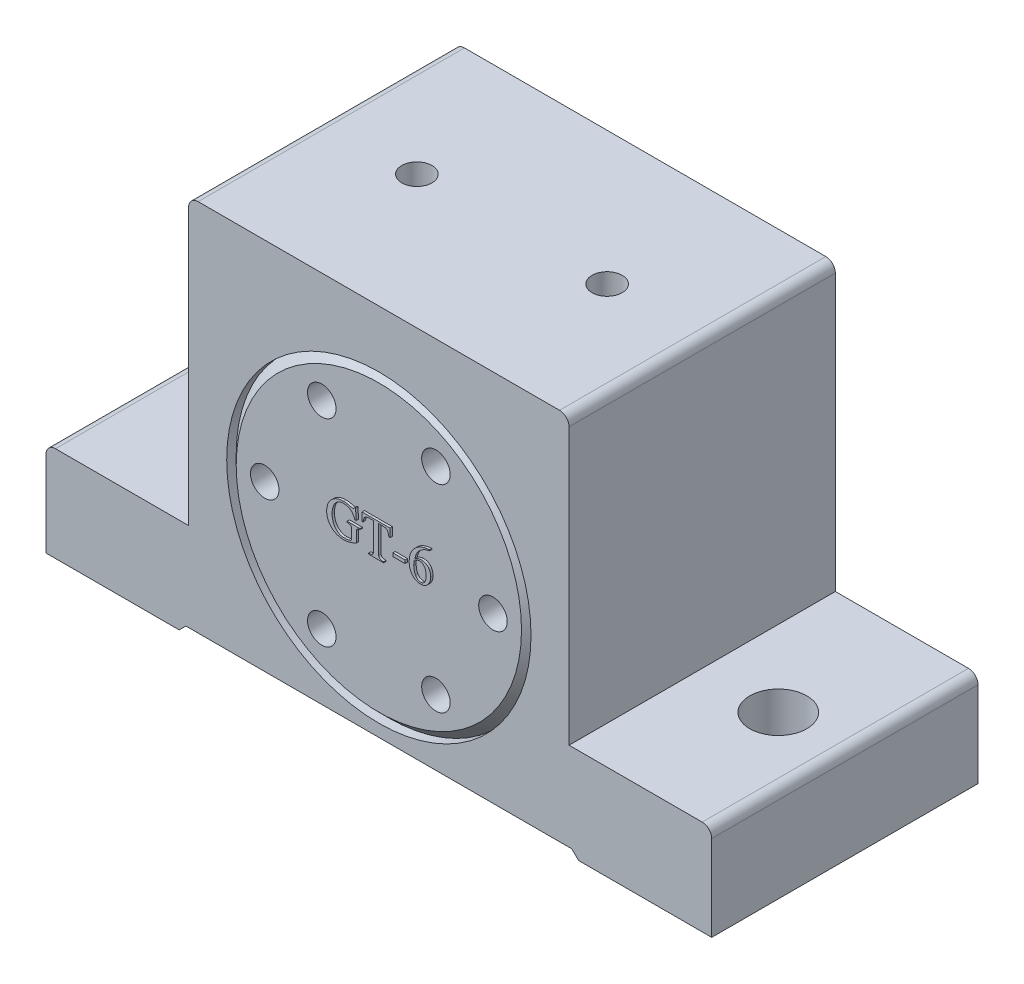
from build123d import *

# Parameters (mm, degrees)
SKETCH1_W                 = 70
SKETCH1_H                 = 28
BOSS_EXTRUDE1_DEPTH       = 10
SKETCH2_W                 = 40
SKETCH2_H                 = 28
BOSS_EXTRUDE2_DEPTH       = 30
F_6_0MM_DOWEL_HOLE1_D     = 6
FILLET1_R                 = 1
FILLET2_R                 = 1
F_6_32_TAPPED_HOLE1_D     = 3.175
F_6_32_TAPPED_HOLE1_DEPTH = 10
F_6_32_TAPPED_HOLE1_TIP   = 0.953866233
SKETCH11_R                = 16
SKETCH11_R_2              = 15
CUT_EXTRUDE1_DEPTH        = 1
CHAMFER1_SIZE             = 1
SKETCH13_R                = 1.5
CUT_EXTRUDE3_DEPTH        = 3
SKETCH14_W                = 1.294520548
SKETCH14_H                = 0.335616438
BOSS_EXTRUDE3_DEPTH       = 0.25
CHAMFER1_OF_MIRROR1_SIZE  = 1
CUT_EXTRUDE2_DEPTH        = 61.074953184
SKETCH15_W                = 1.294520548
SKETCH15_H                = 0.335616438
BOSS_EXTRUDE4_DEPTH       = 0.25


with BuildPart() as part:
    # Sketch1 → Boss-Extrude1 (new body)
    with BuildSketch(Plane(origin=(0, 0, 0), x_dir=(1, 0, 0), z_dir=(0, 1, 0))):
        Rectangle(SKETCH1_W, SKETCH1_H)
    extrude(amount=BOSS_EXTRUDE1_DEPTH)

    # Sketch2 → Boss-Extrude2 (add)
    with BuildSketch(Plane(origin=(0, 10, 0), x_dir=(1, 0, 0), z_dir=(0, 1, 0))):
        Rectangle(SKETCH2_W, SKETCH2_H)
    extrude(amount=BOSS_EXTRUDE2_DEPTH)

    # Ø6.0mm Dowel Hole1 (through all)
    with Locations(Plane(origin=(0, 10, 0), x_dir=(1, 0, 0), z_dir=(0, 1, 0))):
        with Locations((-28, 0), (28, 0)):
            Hole(F_6_0MM_DOWEL_HOLE1_D / 2)

    # Fillet1
    fillet1_edges = [part.edges().sort_by_distance(p)[0] for p in [
        (35, 10, 0),
        (-35, 10, 0),
    ]]
    fillet(fillet1_edges, radius=FILLET1_R)

    # Fillet2
    fillet2_edges = [part.edges().sort_by_distance(p)[0] for p in [
        (-20, 40, 0),
        (20, 40, 0),
    ]]
    fillet(fillet2_edges, radius=FILLET2_R)

    # #6-32 Tapped Hole1
    with Locations(Plane(origin=(0, 40, 0), x_dir=(1, 0, 0), z_dir=(0, 1, 0))):
        with Locations((-10, 0), (10, 0)):
            Hole(F_6_32_TAPPED_HOLE1_D / 2, depth=F_6_32_TAPPED_HOLE1_DEPTH)
            with Locations((0, 0, -(F_6_32_TAPPED_HOLE1_DEPTH + F_6_32_TAPPED_HOLE1_TIP / 2))):  # 118° drill point
                Cone(0, F_6_32_TAPPED_HOLE1_D / 2, F_6_32_TAPPED_HOLE1_TIP, mode=Mode.SUBTRACT)

    # Sketch11 → Cut-Extrude1 (cut)
    with BuildSketch(Plane.XY.offset(14)):
        with Locations((0, 18)):
            Circle(SKETCH11_R)
        with Locations((0, 18)):
            Circle(SKETCH11_R_2, mode=Mode.SUBTRACT)
    cut_extrude1 = extrude(amount=-CUT_EXTRUDE1_DEPTH, mode=Mode.SUBTRACT)

    # Chamfer1
    chamfer1_edges = [part.edges().sort_by_distance(p)[0] for p in [
        (-15, 18, 13),
    ]]
    chamfer(chamfer1_edges, length=CHAMFER1_SIZE - 0.0001)  # a hair under: the kernel refuses the full size

    # Sketch13 → Cut-Extrude3 (cut)
    with BuildSketch(Plane.XY.offset(14)):
        with Locations((12, 18)):
            Circle(SKETCH13_R)
        with Locations((6, 7.607695155)):
            Circle(SKETCH13_R)
        with Locations((-6, 7.607695155)):
            Circle(SKETCH13_R)
        with Locations((-12, 18)):
            Circle(SKETCH13_R)
        with Locations((-6, 28.392304845)):
            Circle(SKETCH13_R)
        with Locations((6, 28.392304845)):
            Circle(SKETCH13_R)
    cut_extrude3 = extrude(amount=-CUT_EXTRUDE3_DEPTH, mode=Mode.SUBTRACT)

    # Sketch14 → Boss-Extrude3 (add)
    # profile 1 of 4: a face of its own
    with BuildSketch(Plane.XY.offset(14)):
        with BuildLine():
            add(Edge.make_bspline(
                [(-1.739432429, 18.884858151), (-1.76947184, 18.883983773), (-1.826025777, 18.882337618), (-1.905135798, 18.866825645), (-1.972343777, 18.84067568), (-2.028603501, 18.804330982), (-2.071428699, 18.755601741), (-2.102178768, 18.696591468), (-2.119994879, 18.627170215), (-2.121960671, 18.577565796), (-2.122994073, 18.551489144)],
                knots=[0, 0, 0, 0, 1.239001329, 2.332615703, 3.308784426, 4.200724742, 5.069554961, 5.954799651, 6.924854295, 8, 8, 8, 8], degree=3))
            Line((-2.122994073, 18.551489144), (-2.122994073, 17.469725446))
            add(Edge.make_bspline(
                [(-2.122994073, 17.469725446), (-2.184235195, 17.441337352), (-2.303583141, 17.386014057), (-2.481184078, 17.312140431), (-2.6527911, 17.250636324), (-2.817868072, 17.200461608), (-2.975879904, 17.159797216), (-3.127669441, 17.132605261), (-3.27270264, 17.113709566), (-3.367515754, 17.111811494), (-3.413768901, 17.110885548)],
                knots=[0, 0, 0, 0, 1.199725496, 2.338049464, 3.417678333, 4.438440892, 5.404069907, 6.315575426, 7.178278878, 8, 8, 8, 8], degree=3))
            add(Edge.make_bspline(
                [(-3.413768901, 17.110885548), (-3.483525714, 17.112316991), (-3.62003025, 17.115118128), (-3.819081559, 17.141429706), (-4.007539347, 17.182591858), (-4.184415296, 17.242603941), (-4.351659446, 17.317170541), (-4.506923665, 17.411000675), (-4.652433525, 17.520234056), (-4.738447683, 17.605758996), (-4.781705545, 17.648770822)],
                knots=[0, 0, 0, 0, 1.10601814, 2.164326138, 3.17915268, 4.161213173, 5.122074661, 6.077893338, 7.033342586, 8, 8, 8, 8], degree=3))
            add(Edge.make_bspline(
                [(-4.781705545, 17.648770822), (-4.818267902, 17.689781435), (-4.890633642, 17.770951348), (-4.98344663, 17.903903561), (-5.062929847, 18.043141446), (-5.127217836, 18.18965992), (-5.177885241, 18.342866479), (-5.213703385, 18.502677893), (-5.234945975, 18.669531344), (-5.237918502, 18.782912796), (-5.239432429, 18.840658665)],
                knots=[0, 0, 0, 0, 1.006742773, 1.99258728, 2.966642265, 3.942535995, 4.921400946, 5.921194709, 6.941251712, 8, 8, 8, 8], degree=3))
            add(Edge.make_bspline(
                [(-5.239432429, 18.840658665), (-5.237781399, 18.903655708), (-5.234546404, 19.027090812), (-5.211149099, 19.208058545), (-5.171415635, 19.380430815), (-5.11577932, 19.544245684), (-5.045204974, 19.700020142), (-4.957541382, 19.846634192), (-4.854555396, 19.985090074), (-4.736450888, 20.113250443), (-4.606733801, 20.229265603), (-4.468742715, 20.332300882), (-4.321519355, 20.41767582), (-4.167413599, 20.488657176), (-4.005221084, 20.543711607), (-3.834965585, 20.582115448), (-3.656987059, 20.607187082), (-3.535466565, 20.609639194), (-3.473700408, 20.610885548)],
                knots=[0, 0, 0, 0, 1.080545691, 2.117198862, 3.124119818, 4.110324757, 5.080319471, 6.052289168, 7.034998981, 8.035502578, 9.036592937, 10.016750459, 10.984367975, 11.950467093, 12.923125672, 13.916561085, 14.941034463, 16, 16, 16, 16], degree=3))
            add(Edge.make_bspline(
                [(-3.473700408, 20.610885548), (-3.423974204, 20.610046651), (-3.32533639, 20.6083826), (-3.178742633, 20.594286009), (-3.034751869, 20.572374668), (-2.897060261, 20.540198307), (-2.770776161, 20.508162053), (-2.66010227, 20.485587888), (-2.568883439, 20.470621606), (-2.514086357, 20.468138164), (-2.490074552, 20.467049932)],
                knots=[0, 0, 0, 0, 1.197159582, 2.374707746, 3.54323986, 4.701578201, 5.777914313, 6.6800664, 7.421611739, 8, 8, 8, 8], degree=3))
            add(Edge.make_bspline(
                [(-2.490074552, 20.467049932), (-2.468979685, 20.468525149), (-2.428530969, 20.471353828), (-2.374033945, 20.500725624), (-2.332290672, 20.548712388), (-2.316977772, 20.589209827), (-2.308781744, 20.610885548)],
                knots=[0, 0, 0, 0, 1.007193199, 1.931259918, 2.892734066, 4, 4, 4, 4], degree=3))
            Line((-2.308781744, 20.610885548), (-2.194911881, 20.610885548))
            Line((-2.194911881, 20.610885548), (-2.143220956, 19.508145822))
            Line((-2.143220956, 19.508145822), (-2.268327977, 19.508145822))
            add(Edge.make_bspline(
                [(-2.268327977, 19.508145822), (-2.281071306, 19.545039556), (-2.306086328, 19.617461565), (-2.351195826, 19.720731076), (-2.400946409, 19.816790682), (-2.453650125, 19.906615641), (-2.512612054, 19.988375583), (-2.575307751, 20.063659817), (-2.643244675, 20.131318137), (-2.715108576, 20.192392285), (-2.792107824, 20.245653603), (-2.873099351, 20.292462698), (-2.959271222, 20.331469198), (-3.04970408, 20.363672452), (-3.145010371, 20.388370686), (-3.244402421, 20.406305821), (-3.348615015, 20.416879219), (-3.419488054, 20.418351859), (-3.455720956, 20.419104727)],
                knots=[0, 0, 0, 0, 1.158273263, 2.273678194, 3.341159708, 4.368298708, 5.361802656, 6.329845504, 7.273283785, 8.204323484, 9.125515029, 10.048583427, 10.977348367, 11.929193547, 12.894650509, 13.896415442, 14.924570273, 16, 16, 16, 16], degree=3))
            add(Edge.make_bspline(
                [(-3.455720956, 20.419104727), (-3.503012786, 20.418011445), (-3.595626879, 20.415870414), (-3.729984437, 20.39323084), (-3.856841592, 20.358505782), (-3.974827661, 20.307618121), (-4.085680201, 20.243825989), (-4.186823905, 20.164037516), (-4.281397786, 20.071559597), (-4.334876281, 20.000110601), (-4.362184997, 19.963625274)],
                knots=[0, 0, 0, 0, 1.072326228, 2.099993195, 3.083193723, 4.050587198, 5.008019062, 5.977269977, 6.967095844, 8, 8, 8, 8], degree=3))
            add(Edge.make_bspline(
                [(-4.362184997, 19.963625274), (-4.386378007, 19.927601096), (-4.435249011, 19.85483058), (-4.496093018, 19.736229727), (-4.549127385, 19.610273833), (-4.590653856, 19.475076622), (-4.623583492, 19.331599985), (-4.6472848, 19.179664624), (-4.661853499, 19.019241386), (-4.663331862, 18.909611853), (-4.664089963, 18.85339411)],
                knots=[0, 0, 0, 0, 0.890046138, 1.79793457, 2.730814706, 3.692169857, 4.696823079, 5.750191814, 6.846304133, 8, 8, 8, 8], degree=3))
            add(Edge.make_bspline(
                [(-4.664089963, 18.85339411), (-4.663187967, 18.798662399), (-4.661420849, 18.691436372), (-4.644459532, 18.534155115), (-4.617152216, 18.384010473), (-4.577890117, 18.241020098), (-4.528486755, 18.10514245), (-4.468738563, 17.97598349), (-4.395936203, 17.855207394), (-4.314310308, 17.741477141), (-4.222833583, 17.638309054), (-4.122426254, 17.54848342), (-4.014866079, 17.472045694), (-3.89917436, 17.410331909), (-3.77622239, 17.362070306), (-3.645510949, 17.327752154), (-3.507381221, 17.306160211), (-3.412601312, 17.303845409), (-3.364325408, 17.30266637)],
                knots=[0, 0, 0, 0, 1.156412547, 2.265551758, 3.339008266, 4.378653555, 5.395448493, 6.391821337, 7.381124235, 8.371369896, 9.347007419, 10.288900617, 11.212879788, 12.129033041, 13.05323828, 13.998010424, 14.980291741, 16, 16, 16, 16], degree=3))
            add(Edge.make_bspline(
                [(-3.364325408, 17.30266637), (-3.317592799, 17.303445878), (-3.225650288, 17.304979493), (-3.091159113, 17.319498006), (-2.962787789, 17.342979863), (-2.860994456, 17.368803482), (-2.786206352, 17.395178203), (-2.737712693, 17.414943376), (-2.696157863, 17.435871279), (-2.66289805, 17.458815722), (-2.635923815, 17.482452383), (-2.617092513, 17.507961086), (-2.604703325, 17.534862134), (-2.603186753, 17.553511678), (-2.602446127, 17.562619281)],
                knots=[0, 0, 0, 0, 1.975665256, 3.886956615, 5.711694527, 7.491797299, 8.32003784, 9.06327313, 9.705589786, 10.282612917, 10.768470237, 11.214106252, 11.616204631, 12, 12, 12, 12], degree=3))
            Line((-2.602446127, 17.562619281), (-2.602446127, 18.527516542))
            add(Edge.make_bspline(
                [(-2.602446127, 18.527516542), (-2.603703508, 18.555656447), (-2.606096246, 18.609205415), (-2.629076536, 18.68408399), (-2.667430423, 18.747741961), (-2.721933443, 18.799254527), (-2.791425357, 18.838499628), (-2.875523049, 18.86536478), (-2.973805531, 18.882828361), (-3.044355185, 18.88415316), (-3.081898182, 18.884858151)],
                knots=[0, 0, 0, 0, 0.98951328, 1.882999076, 2.728159263, 3.580845107, 4.495530347, 5.516815598, 6.678573455, 8, 8, 8, 8], degree=3))
            Line((-3.081898182, 18.884858151), (-3.081898182, 18.980748562))
            Line((-3.081898182, 18.980748562), (-1.739432429, 18.980748562))
            Line((-1.739432429, 18.980748562), (-1.739432429, 18.884858151))
        make_face()
    # profile 2 of 4: a face of its own
    with BuildSketch(Plane.XY.offset(14)):
        with BuildLine():
            Line((1.43993401, 19.74787185), (1.317823564, 19.74787185))
            add(Edge.make_bspline(
                [(1.317823564, 19.74787185), (1.310264199, 19.779133274), (1.295955722, 19.838305358), (1.272911961, 19.921434783), (1.253127549, 19.994795211), (1.234430766, 20.058006003), (1.216987813, 20.111056062), (1.202517257, 20.154887209), (1.188690148, 20.188447049), (1.178840691, 20.206900261), (1.174737092, 20.214588459)],
                knots=[0, 0, 0, 0, 1.578320812, 2.987468802, 4.233238226, 5.307310078, 6.221953995, 6.973835255, 7.572466902, 8, 8, 8, 8], degree=3))
            add(Edge.make_bspline(
                [(1.174737092, 20.214588459), (1.162987089, 20.230971788), (1.139690494, 20.263454825), (1.095796685, 20.305411253), (1.045218855, 20.340374419), (0.988323492, 20.370236995), (0.92436006, 20.392288813), (0.853713144, 20.407814437), (0.776723376, 20.417732397), (0.72303534, 20.418637102), (0.695285037, 20.419104727)],
                knots=[0, 0, 0, 0, 0.88751667, 1.759668995, 2.660809804, 3.591599553, 4.584102421, 5.633891444, 6.777004475, 8, 8, 8, 8], degree=3))
            Line((0.695285037, 20.419104727), (0.226320996, 20.419104727))
            Line((0.226320996, 20.419104727), (0.226320996, 17.564866713))
            add(Edge.make_bspline(
                [(0.226320996, 17.564866713), (0.227711171, 17.536689009), (0.230367015, 17.482857236), (0.255919327, 17.4076535), (0.298408726, 17.343878307), (0.358684337, 17.292783625), (0.434513121, 17.252731171), (0.527043287, 17.226289981), (0.634939259, 17.208774031), (0.712432775, 17.207470454), (0.753718256, 17.206775959)],
                knots=[0, 0, 0, 0, 0.933336804, 1.783082706, 2.601954345, 3.448456312, 4.379764321, 5.429141126, 6.630348073, 8, 8, 8, 8], degree=3))
            Line((0.753718256, 17.206775959), (0.753718256, 17.110885548))
            Line((0.753718256, 17.110885548), (-0.828473525, 17.110885548))
            Line((-0.828473525, 17.110885548), (-0.828473525, 17.206775959))
            add(Edge.make_bspline(
                [(-0.828473525, 17.206775959), (-0.787188044, 17.207470454), (-0.709694527, 17.208774031), (-0.601798556, 17.226289981), (-0.509268389, 17.252731171), (-0.433439606, 17.292783625), (-0.373163994, 17.343878307), (-0.330674595, 17.4076535), (-0.305122284, 17.482857236), (-0.302466439, 17.536689009), (-0.301076264, 17.564866713)],
                knots=[0, 0, 0, 0, 1.369651927, 2.570858874, 3.620235679, 4.551543688, 5.398045655, 6.216917294, 7.066663196, 8, 8, 8, 8], degree=3))
            Line((-0.301076264, 17.564866713), (-0.301076264, 20.419104727))
            Line((-0.301076264, 20.419104727), (-0.7220951, 20.419104727))
            add(Edge.make_bspline(
                [(-0.7220951, 20.419104727), (-0.754840613, 20.418679266), (-0.817743466, 20.417861973), (-0.907810019, 20.407543175), (-0.989993561, 20.393311719), (-1.063853374, 20.371921706), (-1.129115657, 20.343009389), (-1.186438332, 20.308856973), (-1.235689655, 20.2681277), (-1.261485592, 20.235789257), (-1.274214107, 20.219832466)],
                knots=[0, 0, 0, 0, 1.289740232, 2.477540615, 3.568090296, 4.573823554, 5.49906424, 6.373287038, 7.197329409, 8, 8, 8, 8], degree=3))
            add(Edge.make_bspline(
                [(-1.274214107, 20.219832466), (-1.279595596, 20.210919072), (-1.291849761, 20.190622423), (-1.308814384, 20.15459194), (-1.325803156, 20.109111123), (-1.343560681, 20.054556905), (-1.362135346, 19.990811469), (-1.381760178, 19.918221573), (-1.400856734, 19.83608594), (-1.414072917, 19.778340584), (-1.421046299, 19.74787185)],
                knots=[0, 0, 0, 0, 0.503456748, 1.146419101, 1.922638869, 2.850904366, 3.921183567, 5.134293639, 6.487939951, 8, 8, 8, 8], degree=3))
            Line((-1.421046299, 19.74787185), (-1.547651607, 19.74787185))
            Line((-1.547651607, 19.74787185), (-1.51693671, 20.610885548))
            Line((-1.51693671, 20.610885548), (1.409219112, 20.610885548))
            Line((1.409219112, 20.610885548), (1.43993401, 19.74787185))
        make_face()
    # profile 3 of 4: a face of its own
    with BuildSketch(Plane.XY.offset(14)):
        with Locations((2.35988264, 18.333488288)):
            Rectangle(SKETCH14_W, SKETCH14_H)
    # profile 4 of 4: a face of its own
    with BuildSketch(Plane.XY.offset(14)):
        with BuildLine():
            add(Edge.make_bspline(
                [(5.692074421, 18.293783665), (5.691339047, 18.251285177), (5.689902834, 18.16828404), (5.674929497, 18.046828641), (5.652304092, 17.931101483), (5.619032004, 17.821352192), (5.577011702, 17.717102701), (5.525329064, 17.618950901), (5.464032048, 17.52661215), (5.393956334, 17.441371149), (5.317546832, 17.363085768), (5.233460143, 17.296345498), (5.144913287, 17.238775666), (5.050254523, 17.192206967), (4.950509638, 17.154996736), (4.844745705, 17.13017444), (4.734188251, 17.113673858), (4.658567762, 17.111826514), (4.620049592, 17.110885548)],
                knots=[0, 0, 0, 0, 1.138424546, 2.223385749, 3.274696689, 4.295201745, 5.291904765, 6.282793953, 7.262843492, 8.256869163, 9.236461589, 10.188625493, 11.127955327, 12.061761684, 13.010343885, 13.974521034, 14.968298855, 16, 16, 16, 16], degree=3))
            add(Edge.make_bspline(
                [(4.620049592, 17.110885548), (4.576781652, 17.112249971), (4.492078904, 17.114921009), (4.368102736, 17.133862569), (4.250476884, 17.165836205), (4.139765841, 17.212400229), (4.034592693, 17.269971121), (3.936827329, 17.341951272), (3.845718961, 17.426698299), (3.761437822, 17.523144817), (3.68547987, 17.629828122), (3.619000402, 17.745132508), (3.563982142, 17.868418998), (3.517908397, 17.998888338), (3.482126648, 18.136726939), (3.456704662, 18.282267614), (3.441712177, 18.435305187), (3.439685297, 18.539968625), (3.438649763, 18.593441199)],
                knots=[0, 0, 0, 0, 0.976955377, 1.912520094, 2.825093943, 3.722645334, 4.618778232, 5.526810146, 6.456646236, 7.423786005, 8.414367999, 9.409754318, 10.424428233, 11.458937211, 12.531335076, 13.636521686, 14.79249839, 16, 16, 16, 16], degree=3))
            add(Edge.make_bspline(
                [(3.438649763, 18.593441199), (3.439877345, 18.658704513), (3.442298821, 18.787440119), (3.467848696, 18.976697613), (3.50492468, 19.159843361), (3.560574045, 19.335526337), (3.629632808, 19.505209342), (3.717407159, 19.666334548), (3.816947157, 19.823157459), (3.896079773, 19.919446219), (3.93608127, 19.968120137)],
                knots=[0, 0, 0, 0, 1.047607078, 2.066464669, 3.062342177, 4.045498137, 5.021996458, 5.999943445, 6.988972453, 8, 8, 8, 8], degree=3))
            add(Edge.make_bspline(
                [(3.93608127, 19.968120137), (3.960464832, 19.995904957), (4.008965521, 20.051170997), (4.087510909, 20.128217944), (4.168933922, 20.20113753), (4.254741904, 20.268598746), (4.344019724, 20.331584865), (4.436820682, 20.390265166), (4.533735483, 20.443062716), (4.633588672, 20.492462753), (4.737759129, 20.535315944), (4.845367819, 20.574658525), (4.956613293, 20.609006218), (5.071711471, 20.638066144), (5.190101328, 20.663058977), (5.312431888, 20.682154882), (5.438358891, 20.697415076), (5.52373429, 20.703629199), (5.5669674, 20.706775959)],
                knots=[0, 0, 0, 0, 0.963012201, 1.915501779, 2.864985772, 3.810133893, 4.757988675, 5.711255931, 6.669441194, 7.632739165, 8.612836501, 9.602992112, 10.617732192, 11.645182806, 12.69551986, 13.769616166, 14.870559531, 16, 16, 16, 16], degree=3))
            Line((5.5669674, 20.706775959), (5.577455414, 20.612383836))
            add(Edge.make_bspline(
                [(5.577455414, 20.612383836), (5.529096349, 20.603899473), (5.433103063, 20.587057916), (5.293454235, 20.548799084), (5.15838096, 20.503608417), (5.029601337, 20.447517116), (4.905145557, 20.384137893), (4.787139629, 20.310290255), (4.673434462, 20.228550119), (4.603092026, 20.16698391), (4.567609523, 20.135928357)],
                knots=[0, 0, 0, 0, 1.039676805, 2.063770088, 3.064263804, 4.054889119, 5.036858801, 6.020508793, 7.001494587, 8, 8, 8, 8], degree=3))
            add(Edge.make_bspline(
                [(4.567609523, 20.135928357), (4.532298888, 20.102047119), (4.462593311, 20.035163267), (4.369449469, 19.925720115), (4.287304721, 19.810782974), (4.216777284, 19.689814838), (4.157381358, 19.56346145), (4.109027796, 19.431736384), (4.072996297, 19.294140938), (4.057683971, 19.199896594), (4.049951133, 19.152302501)],
                knots=[0, 0, 0, 0, 1.034200225, 2.04158106, 3.033469562, 4.017839106, 4.998064994, 5.981924621, 6.980856969, 8, 8, 8, 8], degree=3))
            add(Edge.make_bspline(
                [(4.049951133, 19.152302501), (4.079791374, 19.16900983), (4.138084912, 19.201647951), (4.225636856, 19.245692986), (4.311904173, 19.281088326), (4.395141814, 19.311639949), (4.476233827, 19.335094932), (4.555164055, 19.351312757), (4.631694943, 19.362882266), (4.682188023, 19.363840352), (4.706950277, 19.364310206)],
                knots=[0, 0, 0, 0, 1.175784807, 2.296920369, 3.366786594, 4.379748116, 5.344406239, 6.265442073, 7.149357401, 8, 8, 8, 8], degree=3))
            add(Edge.make_bspline(
                [(4.706950277, 19.364310206), (4.744695444, 19.363476916), (4.818191892, 19.361854355), (4.925161133, 19.348404278), (5.025499751, 19.32503913), (5.119709445, 19.292802852), (5.207788574, 19.251604268), (5.289588294, 19.200930109), (5.364753162, 19.140768967), (5.432786254, 19.071410993), (5.494073509, 18.99556015), (5.546984926, 18.912753764), (5.592045004, 18.824231438), (5.628589371, 18.729529629), (5.657416, 18.629021051), (5.676891016, 18.522607637), (5.690532134, 18.410252542), (5.691551378, 18.333282298), (5.692074421, 18.293783665)],
                knots=[0, 0, 0, 0, 1.101175742, 2.144181948, 3.139304406, 4.10254167, 5.044598947, 5.970711362, 6.903877635, 7.846808139, 8.800461266, 9.744404827, 10.709019207, 11.694140181, 12.702066175, 13.755330833, 14.848108567, 16, 16, 16, 16], degree=3))
        make_face()
        with BuildLine():
            add(Edge.make_bspline(
                [(5.212622366, 18.151446336), (5.21201435, 18.192662344), (5.210837573, 18.272433306), (5.202736434, 18.388261608), (5.188630801, 18.496085232), (5.169080163, 18.5961419), (5.145199741, 18.688774212), (5.113155809, 18.772573578), (5.077712561, 18.849158276), (5.03530449, 18.917204917), (4.987421715, 18.977463566), (4.933616519, 19.029590883), (4.874847002, 19.074465512), (4.809730652, 19.110691223), (4.738746348, 19.138166571), (4.662690599, 19.158509064), (4.580989747, 19.170717871), (4.524701464, 19.171913291), (4.495691715, 19.172529384)],
                knots=[0, 0, 0, 0, 1.394582776, 2.699126296, 3.926404794, 5.071464784, 6.147512232, 7.158212172, 8.103087745, 8.998738382, 9.864393069, 10.700939639, 11.527311007, 12.359493626, 13.213063892, 14.096434317, 15.018943932, 16, 16, 16, 16], degree=3))
            add(Edge.make_bspline(
                [(4.495691715, 19.172529384), (4.457809231, 19.170550215), (4.380764644, 19.166525022), (4.266159114, 19.136293653), (4.151134588, 19.088844285), (4.079070683, 19.043803635), (4.041710551, 19.020453185)],
                knots=[0, 0, 0, 0, 0.935559524, 1.902720987, 2.912706425, 4, 4, 4, 4], degree=3))
            add(Edge.make_bspline(
                [(4.041710551, 19.020453185), (4.030632127, 19.011237357), (4.00695271, 18.991539118), (3.981440969, 18.947565959), (3.959073443, 18.893240863), (3.941543786, 18.826177354), (3.929700693, 18.747072191), (3.920387474, 18.656083126), (3.917414269, 18.552504651), (3.917863986, 18.479319559), (3.918101818, 18.440615857)],
                knots=[0, 0, 0, 0, 0.563473274, 1.204387778, 1.971219796, 2.877449815, 3.923165741, 5.118574131, 6.476167144, 8, 8, 8, 8], degree=3))
            add(Edge.make_bspline(
                [(3.918101818, 18.440615857), (3.919412355, 18.402380928), (3.921969378, 18.327779815), (3.933071999, 18.218601355), (3.947319474, 18.114122813), (3.968670924, 18.014976043), (3.993700012, 17.920347007), (4.025597022, 17.831547704), (4.060925583, 17.746971446), (4.089700646, 17.694246817), (4.103889489, 17.668248562)],
                knots=[0, 0, 0, 0, 1.143730031, 2.231559842, 3.280238669, 4.295193579, 5.262550965, 6.20491294, 7.114851382, 8, 8, 8, 8], degree=3))
            add(Edge.make_bspline(
                [(4.103889489, 17.668248562), (4.121479069, 17.639348784), (4.155607465, 17.583275642), (4.216112516, 17.508374541), (4.282436745, 17.444731782), (4.354810878, 17.392257855), (4.433625354, 17.352409748), (4.51780744, 17.323696862), (4.607832814, 17.30604648), (4.669911285, 17.303811215), (4.70170627, 17.30266637)],
                knots=[0, 0, 0, 0, 1.099409185, 2.133141947, 3.121167614, 4.081329256, 5.029323335, 5.982175394, 6.966522497, 8, 8, 8, 8], degree=3))
            add(Edge.make_bspline(
                [(4.70170627, 17.30266637), (4.720735769, 17.303401162), (4.75784605, 17.304834112), (4.812105571, 17.315670465), (4.863432975, 17.333609736), (4.911607661, 17.359560374), (4.957192505, 17.392015986), (4.999259912, 17.432526447), (5.039006448, 17.479527949), (5.074537898, 17.53403771), (5.107823394, 17.59346121), (5.135144722, 17.659354421), (5.158955285, 17.729726552), (5.179501026, 17.804634509), (5.194241466, 17.884612262), (5.204332215, 17.969205928), (5.211486774, 18.058681775), (5.212237011, 18.119967358), (5.212622366, 18.151446336)],
                knots=[0, 0, 0, 0, 0.829717635, 1.618069638, 2.403631806, 3.193112014, 3.997262433, 4.837215108, 5.734085466, 6.676760067, 7.671381335, 8.701290833, 9.783017025, 10.91140516, 12.086521174, 13.32693086, 14.626993802, 16, 16, 16, 16], degree=3))
        make_face(mode=Mode.SUBTRACT)
    extrude(amount=BOSS_EXTRUDE3_DEPTH)

    # Mirror1: Cut-Extrude1, Cut-Extrude3 across plane
    add(cut_extrude1.mirror(Plane.XY), mode=Mode.SUBTRACT)
    add(cut_extrude3.mirror(Plane.XY), mode=Mode.SUBTRACT)

    # Chamfer1 of Mirror1
    chamfer1_of_mirror1_edges = [part.edges().sort_by_distance(p)[0] for p in [
        (-15, 18, -13),
    ]]
    chamfer(chamfer1_of_mirror1_edges, length=CHAMFER1_OF_MIRROR1_SIZE - 0.0001)  # a hair under: the kernel refuses the full size

    # Sketch12 → Cut-Extrude2 (cut, through all)
    with BuildSketch(Plane.XY.offset(14)):
        Polygon((-21, 0), (-20.292893219, 0.707106781), (20.292893219, 0.707106781), (21, 0), align=None)
    extrude(amount=-CUT_EXTRUDE2_DEPTH, mode=Mode.SUBTRACT)

    # Sketch15 → Boss-Extrude4 (add)
    # profile 1 of 4: a face of its own
    with BuildSketch(Plane(origin=(0, 0, -14), x_dir=(-1, 0, 0), z_dir=(0, 0, -1))):
        with BuildLine():
            add(Edge.make_bspline(
                [(-1.846802072, 18.836912946), (-1.876841483, 18.836038568), (-1.93339542, 18.834392413), (-2.012505441, 18.81888044), (-2.079713419, 18.792730475), (-2.135973144, 18.756385777), (-2.178798342, 18.707656535), (-2.209548411, 18.648646263), (-2.227364522, 18.579225009), (-2.229330314, 18.529620591), (-2.230363716, 18.503543939)],
                knots=[0, 0, 0, 0, 1.239001329, 2.332615703, 3.308784426, 4.200724742, 5.069554961, 5.954799651, 6.924854295, 8, 8, 8, 8], degree=3))
            Line((-2.230363716, 18.503543939), (-2.230363716, 17.42178024))
            add(Edge.make_bspline(
                [(-2.230363716, 17.42178024), (-2.291604838, 17.393392146), (-2.410952784, 17.338068851), (-2.588553721, 17.264195226), (-2.760160743, 17.202691118), (-2.925237715, 17.152516403), (-3.083249547, 17.11185201), (-3.235039084, 17.084660055), (-3.380072283, 17.06576436), (-3.474885397, 17.063866289), (-3.521138544, 17.062940343)],
                knots=[0, 0, 0, 0, 1.199725496, 2.338049464, 3.417678333, 4.438440892, 5.404069907, 6.315575426, 7.178278878, 8, 8, 8, 8], degree=3))
            add(Edge.make_bspline(
                [(-3.521138544, 17.062940343), (-3.590895357, 17.064371785), (-3.727399893, 17.067172923), (-3.926451202, 17.093484501), (-4.11490899, 17.134646652), (-4.291784939, 17.194658736), (-4.459029089, 17.269225336), (-4.614293308, 17.36305547), (-4.759803168, 17.472288851), (-4.845817326, 17.557813791), (-4.889075188, 17.600825617)],
                knots=[0, 0, 0, 0, 1.10601814, 2.164326138, 3.17915268, 4.161213173, 5.122074661, 6.077893338, 7.033342586, 8, 8, 8, 8], degree=3))
            add(Edge.make_bspline(
                [(-4.889075188, 17.600825617), (-4.925637545, 17.641836229), (-4.998003285, 17.723006143), (-5.090816273, 17.855958355), (-5.17029949, 17.995196241), (-5.234587479, 18.141714715), (-5.285254884, 18.294921274), (-5.321073028, 18.454732688), (-5.342315618, 18.621586138), (-5.345288145, 18.73496759), (-5.346802072, 18.792713459)],
                knots=[0, 0, 0, 0, 1.006742773, 1.99258728, 2.966642265, 3.942535995, 4.921400946, 5.921194709, 6.941251712, 8, 8, 8, 8], degree=3))
            add(Edge.make_bspline(
                [(-5.346802072, 18.792713459), (-5.345151042, 18.855710503), (-5.341916047, 18.979145606), (-5.318518742, 19.16011334), (-5.278785278, 19.33248561), (-5.223148963, 19.496300478), (-5.152574617, 19.652074936), (-5.064911025, 19.798688987), (-4.961925039, 19.937144868), (-4.843820531, 20.065305238), (-4.714103444, 20.181320397), (-4.576112358, 20.284355676), (-4.428888998, 20.369730614), (-4.274783242, 20.440711971), (-4.112590727, 20.495766401), (-3.942335228, 20.534170243), (-3.764356702, 20.559241876), (-3.642836208, 20.561693989), (-3.581070051, 20.562940343)],
                knots=[0, 0, 0, 0, 1.080545691, 2.117198862, 3.124119818, 4.110324757, 5.080319471, 6.052289168, 7.034998981, 8.035502578, 9.036592937, 10.016750459, 10.984367975, 11.950467093, 12.923125672, 13.916561085, 14.941034463, 16, 16, 16, 16], degree=3))
            add(Edge.make_bspline(
                [(-3.581070051, 20.562940343), (-3.531343847, 20.562101446), (-3.432706033, 20.560437395), (-3.286112276, 20.546340804), (-3.142121512, 20.524429462), (-3.004429904, 20.492253102), (-2.878145804, 20.460216848), (-2.767471913, 20.437642682), (-2.676253081, 20.4226764), (-2.621456, 20.420192958), (-2.597444195, 20.419104727)],
                knots=[0, 0, 0, 0, 1.197159582, 2.374707746, 3.54323986, 4.701578201, 5.777914313, 6.6800664, 7.421611739, 8, 8, 8, 8], degree=3))
            add(Edge.make_bspline(
                [(-2.597444195, 20.419104727), (-2.576349328, 20.420579943), (-2.535900611, 20.423408623), (-2.481403588, 20.452780418), (-2.439660315, 20.500767183), (-2.424347415, 20.541264621), (-2.416151387, 20.562940343)],
                knots=[0, 0, 0, 0, 1.007193199, 1.931259918, 2.892734066, 4, 4, 4, 4], degree=3))
            Line((-2.416151387, 20.562940343), (-2.302281524, 20.562940343))
            Line((-2.302281524, 20.562940343), (-2.250590599, 19.460200617))
            Line((-2.250590599, 19.460200617), (-2.37569762, 19.460200617))
            add(Edge.make_bspline(
                [(-2.37569762, 19.460200617), (-2.388440949, 19.49709435), (-2.413455971, 19.569516359), (-2.458565469, 19.67278587), (-2.508316052, 19.768845477), (-2.561019768, 19.858670435), (-2.619981696, 19.940430377), (-2.682677394, 20.015714611), (-2.750614318, 20.083372931), (-2.822478219, 20.144447079), (-2.899477467, 20.197708398), (-2.980468994, 20.244517492), (-3.066640865, 20.283523993), (-3.157073723, 20.315727246), (-3.252380014, 20.34042548), (-3.351772064, 20.358360616), (-3.455984658, 20.368934014), (-3.526857697, 20.370406654), (-3.563090599, 20.371159521)],
                knots=[0, 0, 0, 0, 1.158273263, 2.273678194, 3.341159708, 4.368298708, 5.361802656, 6.329845504, 7.273283785, 8.204323484, 9.125515029, 10.048583427, 10.977348367, 11.929193547, 12.894650509, 13.896415442, 14.924570273, 16, 16, 16, 16], degree=3))
            add(Edge.make_bspline(
                [(-3.563090599, 20.371159521), (-3.610382429, 20.37006624), (-3.702996522, 20.367925209), (-3.83735408, 20.345285634), (-3.964211235, 20.310560576), (-4.082197304, 20.259672916), (-4.193049844, 20.195880783), (-4.294193548, 20.116092311), (-4.388767429, 20.023614392), (-4.442245924, 19.952165395), (-4.46955464, 19.915680069)],
                knots=[0, 0, 0, 0, 1.072326228, 2.099993195, 3.083193723, 4.050587198, 5.008019062, 5.977269977, 6.967095844, 8, 8, 8, 8], degree=3))
            add(Edge.make_bspline(
                [(-4.46955464, 19.915680069), (-4.49374765, 19.87965589), (-4.542618654, 19.806885374), (-4.603462661, 19.688284522), (-4.656497028, 19.562328628), (-4.698023499, 19.427131417), (-4.730953135, 19.28365478), (-4.754654443, 19.131719419), (-4.769223142, 18.971296181), (-4.770701505, 18.861666648), (-4.771459606, 18.805448905)],
                knots=[0, 0, 0, 0, 0.890046138, 1.79793457, 2.730814706, 3.692169857, 4.696823079, 5.750191814, 6.846304133, 8, 8, 8, 8], degree=3))
            add(Edge.make_bspline(
                [(-4.771459606, 18.805448905), (-4.77055761, 18.750717194), (-4.768790492, 18.643491166), (-4.751829175, 18.48620991), (-4.724521859, 18.336065267), (-4.68525976, 18.193074892), (-4.635856398, 18.057197245), (-4.576108206, 17.928038285), (-4.503305846, 17.807262189), (-4.421679951, 17.693531935), (-4.330203226, 17.590363848), (-4.229795897, 17.500538214), (-4.122235722, 17.424100489), (-4.006544003, 17.362386704), (-3.883592033, 17.314125101), (-3.752880591, 17.279806948), (-3.614750864, 17.258215005), (-3.519970955, 17.255900203), (-3.471695051, 17.254721165)],
                knots=[0, 0, 0, 0, 1.156412547, 2.265551758, 3.339008266, 4.378653555, 5.395448493, 6.391821337, 7.381124235, 8.371369896, 9.347007419, 10.288900617, 11.212879788, 12.129033041, 13.05323828, 13.998010424, 14.980291741, 16, 16, 16, 16], degree=3))
            add(Edge.make_bspline(
                [(-3.471695051, 17.254721165), (-3.424962442, 17.255500672), (-3.333019931, 17.257034288), (-3.198528756, 17.2715528), (-3.070157432, 17.295034657), (-2.968364099, 17.320858276), (-2.893575995, 17.347232997), (-2.845082336, 17.36699817), (-2.803527506, 17.387926074), (-2.770267693, 17.410870516), (-2.743293458, 17.434507177), (-2.724462156, 17.46001588), (-2.712072968, 17.486916928), (-2.710556396, 17.505566472), (-2.70981577, 17.514674076)],
                knots=[0, 0, 0, 0, 1.975665256, 3.886956615, 5.711694527, 7.491797299, 8.32003784, 9.06327313, 9.705589786, 10.282612917, 10.768470237, 11.214106252, 11.616204631, 12, 12, 12, 12], degree=3))
            Line((-2.70981577, 17.514674076), (-2.70981577, 18.479571336))
            add(Edge.make_bspline(
                [(-2.70981577, 18.479571336), (-2.711073151, 18.507711241), (-2.713465889, 18.561260209), (-2.736446179, 18.636138784), (-2.774800066, 18.699796755), (-2.829303086, 18.751309322), (-2.898794999, 18.790554422), (-2.982892692, 18.817419575), (-3.081175174, 18.834883156), (-3.151724828, 18.836207954), (-3.189267825, 18.836912946)],
                knots=[0, 0, 0, 0, 0.98951328, 1.882999076, 2.728159263, 3.580845107, 4.495530347, 5.516815598, 6.678573455, 8, 8, 8, 8], degree=3))
            Line((-3.189267825, 18.836912946), (-3.189267825, 18.932803357))
            Line((-3.189267825, 18.932803357), (-1.846802072, 18.932803357))
            Line((-1.846802072, 18.932803357), (-1.846802072, 18.836912946))
        make_face()
    # profile 2 of 4: a face of its own
    with BuildSketch(Plane(origin=(0, 0, -14), x_dir=(-1, 0, 0), z_dir=(0, 0, -1))):
        with BuildLine():
            Line((1.332564367, 19.699926644), (1.210453921, 19.699926644))
            add(Edge.make_bspline(
                [(1.210453921, 19.699926644), (1.202894556, 19.731188069), (1.188586079, 19.790360153), (1.165542318, 19.873489578), (1.145757907, 19.946850006), (1.127061123, 20.010060798), (1.10961817, 20.063110857), (1.095147614, 20.106942003), (1.081320505, 20.140501844), (1.071471048, 20.158955055), (1.067367449, 20.166643254)],
                knots=[0, 0, 0, 0, 1.578320812, 2.987468802, 4.233238226, 5.307310078, 6.221953995, 6.973835255, 7.572466902, 8, 8, 8, 8], degree=3))
            add(Edge.make_bspline(
                [(1.067367449, 20.166643254), (1.055617446, 20.183026583), (1.032320851, 20.215509619), (0.988427042, 20.257466047), (0.937849212, 20.292429213), (0.880953849, 20.32229179), (0.816990417, 20.344343607), (0.746343501, 20.359869232), (0.669353733, 20.369787191), (0.615665697, 20.370691897), (0.587915394, 20.371159521)],
                knots=[0, 0, 0, 0, 0.88751667, 1.759668995, 2.660809804, 3.591599553, 4.584102421, 5.633891444, 6.777004475, 8, 8, 8, 8], degree=3))
            Line((0.587915394, 20.371159521), (0.118951353, 20.371159521))
            Line((0.118951353, 20.371159521), (0.118951353, 17.516921507))
            add(Edge.make_bspline(
                [(0.118951353, 17.516921507), (0.120341528, 17.488743804), (0.122997372, 17.43491203), (0.148549684, 17.359708295), (0.191039083, 17.295933102), (0.251314695, 17.244838419), (0.327143478, 17.204785965), (0.419673644, 17.178344776), (0.527569616, 17.160828825), (0.605063132, 17.159525248), (0.646348613, 17.158830754)],
                knots=[0, 0, 0, 0, 0.933336804, 1.783082706, 2.601954345, 3.448456312, 4.379764321, 5.429141126, 6.630348073, 8, 8, 8, 8], degree=3))
            Line((0.646348613, 17.158830754), (0.646348613, 17.062940343))
            Line((0.646348613, 17.062940343), (-0.935843168, 17.062940343))
            Line((-0.935843168, 17.062940343), (-0.935843168, 17.158830754))
            add(Edge.make_bspline(
                [(-0.935843168, 17.158830754), (-0.894557687, 17.159525248), (-0.81706417, 17.160828825), (-0.709168199, 17.178344776), (-0.616638032, 17.204785965), (-0.540809249, 17.244838419), (-0.480533637, 17.295933102), (-0.438044238, 17.359708295), (-0.412491927, 17.43491203), (-0.409836082, 17.488743804), (-0.408445907, 17.516921507)],
                knots=[0, 0, 0, 0, 1.369651927, 2.570858874, 3.620235679, 4.551543688, 5.398045655, 6.216917294, 7.066663196, 8, 8, 8, 8], degree=3))
            Line((-0.408445907, 17.516921507), (-0.408445907, 20.371159521))
            Line((-0.408445907, 20.371159521), (-0.829464743, 20.371159521))
            add(Edge.make_bspline(
                [(-0.829464743, 20.371159521), (-0.862210256, 20.370734061), (-0.925113109, 20.369916767), (-1.015179662, 20.35959797), (-1.097363204, 20.345366513), (-1.171223017, 20.323976501), (-1.2364853, 20.295064183), (-1.293807975, 20.260911768), (-1.343059298, 20.220182495), (-1.368855235, 20.187844051), (-1.38158375, 20.171887261)],
                knots=[0, 0, 0, 0, 1.289740232, 2.477540615, 3.568090296, 4.573823554, 5.49906424, 6.373287038, 7.197329409, 8, 8, 8, 8], degree=3))
            add(Edge.make_bspline(
                [(-1.38158375, 20.171887261), (-1.386965239, 20.162973867), (-1.399219404, 20.142677217), (-1.416184027, 20.106646734), (-1.433172799, 20.061165917), (-1.450930324, 20.006611699), (-1.469504989, 19.942866263), (-1.489129821, 19.870276367), (-1.508226377, 19.788140734), (-1.52144256, 19.730395379), (-1.528415942, 19.699926644)],
                knots=[0, 0, 0, 0, 0.503456748, 1.146419101, 1.922638869, 2.850904366, 3.921183567, 5.134293639, 6.487939951, 8, 8, 8, 8], degree=3))
            Line((-1.528415942, 19.699926644), (-1.65502125, 19.699926644))
            Line((-1.65502125, 19.699926644), (-1.624306352, 20.562940343))
            Line((-1.624306352, 20.562940343), (1.301849469, 20.562940343))
            Line((1.301849469, 20.562940343), (1.332564367, 19.699926644))
        make_face()
    # profile 3 of 4: a face of its own
    with BuildSketch(Plane(origin=(0, 0, -14), x_dir=(-1, 0, 0), z_dir=(0, 0, -1))):
        with Locations((2.252512997, 18.285543083)):
            Rectangle(SKETCH15_W, SKETCH15_H)
    # profile 4 of 4: a face of its own
    with BuildSketch(Plane(origin=(0, 0, -14), x_dir=(-1, 0, 0), z_dir=(0, 0, -1))):
        with BuildLine():
            add(Edge.make_bspline(
                [(5.584704778, 18.245838459), (5.583969404, 18.203339972), (5.582533191, 18.120338835), (5.567559854, 17.998883436), (5.544934449, 17.883156277), (5.511662361, 17.773406986), (5.469642059, 17.669157495), (5.417959421, 17.571005695), (5.356662405, 17.478666944), (5.286586691, 17.393425944), (5.210177189, 17.315140563), (5.1260905, 17.248400292), (5.037543644, 17.190830461), (4.94288488, 17.144261762), (4.843139996, 17.10705153), (4.737376062, 17.082229234), (4.626818608, 17.065728652), (4.55119812, 17.063881309), (4.512679949, 17.062940343)],
                knots=[0, 0, 0, 0, 1.138424546, 2.223385749, 3.274696689, 4.295201745, 5.291904765, 6.282793953, 7.262843492, 8.256869163, 9.236461589, 10.188625493, 11.127955327, 12.061761684, 13.010343885, 13.974521034, 14.968298855, 16, 16, 16, 16], degree=3))
            add(Edge.make_bspline(
                [(4.512679949, 17.062940343), (4.469412009, 17.064304765), (4.384709261, 17.066975804), (4.260733094, 17.085917364), (4.143107242, 17.117890999), (4.032396198, 17.164455024), (3.92722305, 17.222025915), (3.829457686, 17.294006067), (3.738349318, 17.378753094), (3.654068179, 17.475199611), (3.578110227, 17.581882917), (3.511630759, 17.697187303), (3.456612499, 17.820473792), (3.410538754, 17.950943132), (3.374757005, 18.088781734), (3.349335019, 18.234322409), (3.334342534, 18.387359982), (3.332315654, 18.492023419), (3.33128012, 18.545495994)],
                knots=[0, 0, 0, 0, 0.976955377, 1.912520094, 2.825093943, 3.722645334, 4.618778232, 5.526810146, 6.456646236, 7.423786005, 8.414367999, 9.409754318, 10.424428233, 11.458937211, 12.531335076, 13.636521686, 14.79249839, 16, 16, 16, 16], degree=3))
            add(Edge.make_bspline(
                [(3.33128012, 18.545495994), (3.332507702, 18.610759308), (3.334929178, 18.739494914), (3.360479054, 18.928752407), (3.397555037, 19.111898155), (3.453204402, 19.287581131), (3.522263165, 19.457264136), (3.610037516, 19.618389342), (3.709577514, 19.775212253), (3.78871013, 19.871501014), (3.828711627, 19.920174932)],
                knots=[0, 0, 0, 0, 1.047607078, 2.066464669, 3.062342177, 4.045498137, 5.021996458, 5.999943445, 6.988972453, 8, 8, 8, 8], degree=3))
            add(Edge.make_bspline(
                [(3.828711627, 19.920174932), (3.853095189, 19.947959751), (3.901595878, 20.003225792), (3.980141266, 20.080272739), (4.061564279, 20.153192325), (4.147372261, 20.220653541), (4.236650081, 20.283639659), (4.329451039, 20.342319961), (4.42636584, 20.395117511), (4.526219029, 20.444517547), (4.630389486, 20.487370739), (4.737998176, 20.526713319), (4.84924365, 20.561061013), (4.964341828, 20.590120938), (5.082731685, 20.615113771), (5.205062245, 20.634209677), (5.330989248, 20.64946987), (5.416364647, 20.655683994), (5.459597757, 20.658830754)],
                knots=[0, 0, 0, 0, 0.963012201, 1.915501779, 2.864985772, 3.810133893, 4.757988675, 5.711255931, 6.669441194, 7.632739165, 8.612836501, 9.602992112, 10.617732192, 11.645182806, 12.69551986, 13.769616166, 14.870559531, 16, 16, 16, 16], degree=3))
            Line((5.459597757, 20.658830754), (5.470085771, 20.564438631))
            add(Edge.make_bspline(
                [(5.470085771, 20.564438631), (5.421726706, 20.555954267), (5.32573342, 20.539112711), (5.186084593, 20.500853879), (5.051011317, 20.455663212), (4.922231694, 20.39957191), (4.797775914, 20.336192687), (4.679769986, 20.262345049), (4.566064819, 20.180604914), (4.495722383, 20.119038704), (4.46023988, 20.087983151)],
                knots=[0, 0, 0, 0, 1.039676805, 2.063770088, 3.064263804, 4.054889119, 5.036858801, 6.020508793, 7.001494587, 8, 8, 8, 8], degree=3))
            add(Edge.make_bspline(
                [(4.46023988, 20.087983151), (4.424929245, 20.054101913), (4.355223668, 19.987218062), (4.262079826, 19.87777491), (4.179935078, 19.762837769), (4.109407641, 19.641869633), (4.050011715, 19.515516245), (4.001658153, 19.383791178), (3.965626654, 19.246195733), (3.950314328, 19.151951388), (3.94258149, 19.104357295)],
                knots=[0, 0, 0, 0, 1.034200225, 2.04158106, 3.033469562, 4.017839106, 4.998064994, 5.981924621, 6.980856969, 8, 8, 8, 8], degree=3))
            add(Edge.make_bspline(
                [(3.94258149, 19.104357295), (3.972421731, 19.121064625), (4.030715269, 19.153702745), (4.118267213, 19.197747781), (4.20453453, 19.23314312), (4.287772171, 19.263694744), (4.368864184, 19.287149726), (4.447794412, 19.303367551), (4.5243253, 19.314937061), (4.57481838, 19.315895147), (4.599580634, 19.316365001)],
                knots=[0, 0, 0, 0, 1.175784807, 2.296920369, 3.366786594, 4.379748116, 5.344406239, 6.265442073, 7.149357401, 8, 8, 8, 8], degree=3))
            add(Edge.make_bspline(
                [(4.599580634, 19.316365001), (4.637325801, 19.315531711), (4.710822249, 19.31390915), (4.81779149, 19.300459073), (4.918130108, 19.277093924), (5.012339802, 19.244857646), (5.100418931, 19.203659062), (5.182218651, 19.152984904), (5.257383519, 19.092823761), (5.325416611, 19.023465788), (5.386703866, 18.947614944), (5.439615283, 18.864808559), (5.484675361, 18.776286233), (5.521219729, 18.681584423), (5.550046358, 18.581075845), (5.569521373, 18.474662432), (5.583162491, 18.362307337), (5.584181735, 18.285337093), (5.584704778, 18.245838459)],
                knots=[0, 0, 0, 0, 1.101175742, 2.144181948, 3.139304406, 4.10254167, 5.044598947, 5.970711362, 6.903877635, 7.846808139, 8.800461266, 9.744404827, 10.709019207, 11.694140181, 12.702066175, 13.755330833, 14.848108567, 16, 16, 16, 16], degree=3))
        make_face()
        with BuildLine():
            add(Edge.make_bspline(
                [(5.105252723, 18.103501131), (5.104644707, 18.144717138), (5.10346793, 18.2244881), (5.095366791, 18.340316402), (5.081261159, 18.448140026), (5.06171052, 18.548196694), (5.037830098, 18.640829007), (5.005786166, 18.724628373), (4.970342918, 18.80121307), (4.927934847, 18.869259712), (4.880052072, 18.92951836), (4.826246876, 18.981645677), (4.767477359, 19.026520307), (4.702361009, 19.062746017), (4.631376705, 19.090221366), (4.555320956, 19.110563858), (4.473620104, 19.122772666), (4.417331821, 19.123968085), (4.388322072, 19.124584179)],
                knots=[0, 0, 0, 0, 1.394582776, 2.699126296, 3.926404794, 5.071464784, 6.147512232, 7.158212172, 8.103087745, 8.998738382, 9.864393069, 10.700939639, 11.527311007, 12.359493626, 13.213063892, 14.096434317, 15.018943932, 16, 16, 16, 16], degree=3))
            add(Edge.make_bspline(
                [(4.388322072, 19.124584179), (4.350439588, 19.122605009), (4.273395001, 19.118579817), (4.158789471, 19.088348447), (4.043764945, 19.040899079), (3.97170104, 18.99585843), (3.934340908, 18.97250798)],
                knots=[0, 0, 0, 0, 0.935559524, 1.902720987, 2.912706425, 4, 4, 4, 4], degree=3))
            add(Edge.make_bspline(
                [(3.934340908, 18.97250798), (3.923262484, 18.963292151), (3.899583067, 18.943593912), (3.874071326, 18.899620754), (3.8517038, 18.845295658), (3.834174143, 18.778232148), (3.82233105, 18.699126986), (3.813017831, 18.608137921), (3.810044626, 18.504559446), (3.810494343, 18.431374353), (3.810732175, 18.392670651)],
                knots=[0, 0, 0, 0, 0.563473274, 1.204387778, 1.971219796, 2.877449815, 3.923165741, 5.118574131, 6.476167144, 8, 8, 8, 8], degree=3))
            add(Edge.make_bspline(
                [(3.810732175, 18.392670651), (3.812042712, 18.354435722), (3.814599735, 18.27983461), (3.825702356, 18.170656149), (3.839949831, 18.066177608), (3.861301281, 17.967030838), (3.886330369, 17.872401802), (3.918227379, 17.783602499), (3.95355594, 17.69902624), (3.982331004, 17.646301612), (3.996519846, 17.620303357)],
                knots=[0, 0, 0, 0, 1.143730031, 2.231559842, 3.280238669, 4.295193579, 5.262550965, 6.20491294, 7.114851382, 8, 8, 8, 8], degree=3))
            add(Edge.make_bspline(
                [(3.996519846, 17.620303357), (4.014109426, 17.591403579), (4.048237822, 17.535330436), (4.108742874, 17.460429335), (4.175067102, 17.396786577), (4.247441235, 17.344312649), (4.326255711, 17.304464542), (4.410437797, 17.275751656), (4.500463171, 17.258101275), (4.562541642, 17.25586601), (4.594336627, 17.254721165)],
                knots=[0, 0, 0, 0, 1.099409185, 2.133141947, 3.121167614, 4.081329256, 5.029323335, 5.982175394, 6.966522497, 8, 8, 8, 8], degree=3))
            add(Edge.make_bspline(
                [(4.594336627, 17.254721165), (4.613366126, 17.255455956), (4.650476407, 17.256888906), (4.704735928, 17.26772526), (4.756063332, 17.285664531), (4.804238018, 17.311615168), (4.849822862, 17.34407078), (4.891890269, 17.384581242), (4.931636805, 17.431582744), (4.967168255, 17.486092505), (5.000453751, 17.545516005), (5.027775079, 17.611409215), (5.051585642, 17.681781346), (5.072131383, 17.756689303), (5.086871823, 17.836667057), (5.096962572, 17.921260722), (5.104117131, 18.010736569), (5.104867368, 18.072022152), (5.105252723, 18.103501131)],
                knots=[0, 0, 0, 0, 0.829717635, 1.618069638, 2.403631806, 3.193112014, 3.997262433, 4.837215108, 5.734085466, 6.676760067, 7.671381335, 8.701290833, 9.783017025, 10.91140516, 12.086521174, 13.32693086, 14.626993802, 16, 16, 16, 16], degree=3))
        make_face(mode=Mode.SUBTRACT)
    extrude(amount=BOSS_EXTRUDE4_DEPTH)


solid = part.part
